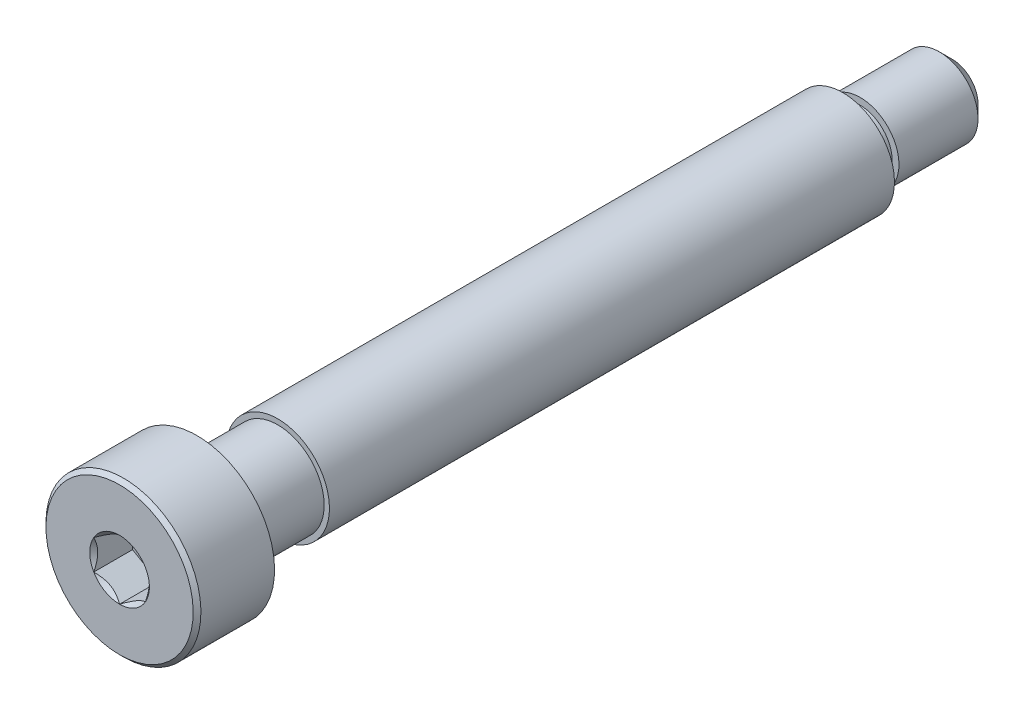
from build123d import *

# Parameters (mm, degrees)
CUT_EXTRUDE1_START = 16.121
CUT_EXTRUDE1_DEPTH = 1.5
CHAMFER2_SIZE      = 0.506148016


# Read off the part's stored shape, not the designer's step: Cut-Revolve-Thin1
with BuildPart() as part:
    # Sketch3 → Revolve1 (revolve)
    with BuildSketch(Plane(origin=(0, 0, 0), x_dir=(0, 0, -1), z_dir=(1, 0, 0)), mode=Mode.PRIVATE) as revolve1_sk:
        with BuildLine():
            Line((-16.121, 0), (-16.121, 2.805))
            Line((-16.121, 2.805), (-16.121, 3))
            Line((-16.121, 3), (-13.316, 3))
            Line((-13.316, 3), (-13.121, 3))
            Line((-13.121, 3), (-13.121, 1.797))
            Line((-13.121, 1.797), (-9.996, 1.797))
            Line((-9.996, 1.797), (-9.996, 2))
            Line((-9.996, 2), (11.879, 2))
            Line((11.879, 2), (11.879, 1.36904775))
            ThreePointArc((11.879, 1.36904775), (11.917355026, 1.276450526), (12.00995225, 1.2380955))
            Line((12.00995225, 1.2380955), (12.553864022, 1.2380955))
            Line((12.553864022, 1.2380955), (12.553864022, 1.5))
            Line((12.553864022, 1.5), (15.746, 1.5))
            Line((15.746, 1.5), (16.121, 1.5))
            Line((16.121, 1.5), (16.121, 0))
            Line((16.121, 0), (-16.121, 0))
        make_face()
    revolve(revolve1_sk.sketch.rotate(Axis((0, 0, 16.121), (0, 0, -1)), 180), axis=Axis((0, 0, 16.121), (0, 0, -1)))

    # Cut-Revolve-Thin1 outline → Cut-Revolve-Thin1 (revolve, cut)
    with BuildSketch(Plane.XZ):
        Polygon((1.758903511, 9.996517241), (1.461903511, -11.878482759), (1.5, -11.879), (1.797, 9.996), align=None)
    revolve(axis=Axis((0, 0, 0), (0, 0, 1)), mode=Mode.SUBTRACT)

    # Sketch4 → Cut-Extrude1 (cut)
    with BuildSketch(Plane.XY.offset(CUT_EXTRUDE1_START)):
        Polygon((0, 1.154700538), (-1, 0.577350269), (-1, -0.577350269), (0, -1.154700538), (1, -0.577350269), (1, 0.577350269), align=None)
    extrude(amount=-CUT_EXTRUDE1_DEPTH, mode=Mode.SUBTRACT)

    # Cut-Extrude2 cone 1 section (through the dimple's axis) → Cut-Extrude2 (revolve, cut)
    with BuildSketch(Plane(origin=(0, 0, 16.121), x_dir=(0, -1, 0), z_dir=(1, 0, 0))):
        Polygon((0, 0), (1.154700538, 0), (0, 1.154700538), align=None)
    revolve(axis=Axis((0, 0, 16.121), (0, 0, -1)), mode=Mode.SUBTRACT)

    # Chamfer2
    chamfer2_edges = [part.edges().sort_by_distance(p)[0] for p in [
        (0, 1.5, -16.121),
    ]]
    chamfer(chamfer2_edges, length=CHAMFER2_SIZE)

    # Sketch10 → Cut-Revolve2 (revolve, cut)
    with BuildSketch(Plane(origin=(0, 0, 0), x_dir=(0, 0, -1), z_dir=(1, 0, 0)), mode=Mode.PRIVATE) as cut_revolve2_sk:
        Polygon((-16.121, 2.85), (-15.971, 3), (-16.121, 3), align=None)
    revolve(cut_revolve2_sk.sketch.rotate(Axis((0, 0, 16.121), (0, 0, -1)), 180), axis=Axis((0, 0, 16.121), (0, 0, -1)), mode=Mode.SUBTRACT)


solid = part.part
